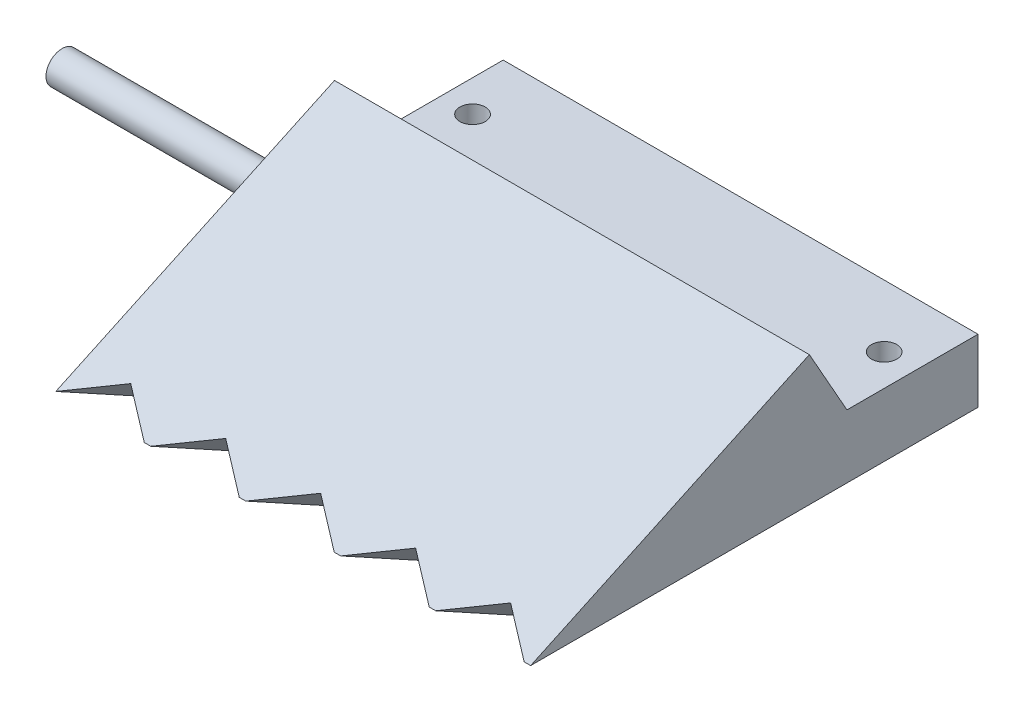
from build123d import *

# Parameters (mm, degrees)
BOSS_EXTRUDE1_DEPTH = 75
SKETCH2_R           = 2
CUT_EXTRUDE1_DEPTH  = 10
CUT_EXTRUDE2_DEPTH  = 10
CHAMFER1_SIZE       = 2
SKETCH3_R           = 2.543008444
BOSS_EXTRUDE2_DEPTH = 40


with BuildPart() as part:
    # Sketch1 → Boss-Extrude1 (new body)
    with BuildSketch(Plane(origin=(0, 0, 0), x_dir=(0, 0, -1), z_dir=(1, 0, 0))):
        Polygon((-35.447605249, 4.173188871), (35.206481481, 4.173188871), (35.206481481, 14.173188871), (14.511910864, 14.173188871), (8.571096195, 24.699446456), align=None)
    extrude(amount=BOSS_EXTRUDE1_DEPTH)

    # Sketch2 → Cut-Extrude1 (cut)
    with BuildSketch(Plane(origin=(0, 14.173188871, 0), x_dir=(1, 0, 0), z_dir=(0, 1, 0))):
        with Locations((5, 25.374559272)):
            Circle(SKETCH2_R)
        with Locations((69.999998955, 25.38621548)):
            Circle(SKETCH2_R)
    extrude(amount=-CUT_EXTRUDE1_DEPTH, mode=Mode.SUBTRACT)

    # Sketch4 → Cut-Extrude2 (cut)
    with BuildSketch(Plane(origin=(0, 17.005051997, 7.929585973), x_dir=(1, 0, 0), z_dir=(0, 0.9063077870366527, 0.4226182617406937))):
        Polygon((0, -30.362774842), (7.065850082, -25.103103439), (13.976560291, -30.362774842), align=None)
        Polygon((22.065850082, -25.103103439), (28.976560291, -30.362774842), (15, -30.362774842), align=None)
        Polygon((37.065850082, -25.103103439), (43.976560291, -30.362774842), (30, -30.362774842), align=None)
        Polygon((52.065850082, -25.103103439), (58.976560291, -30.362774842), (45, -30.362774842), align=None)
        Polygon((67.065850082, -25.103103439), (73.976560291, -30.362774842), (60, -30.362774842), align=None)
    extrude(amount=-CUT_EXTRUDE2_DEPTH, mode=Mode.SUBTRACT)

    # Chamfer1
    chamfer1_edges = [part.edges().sort_by_distance(p)[0] for p in [
        (67.999998955, 4.173188871, -25.38621548),
        (3, 4.173188871, -25.374559272),
    ]]
    chamfer(chamfer1_edges, length=CHAMFER1_SIZE)

    # Sketch3 → Boss-Extrude2 (add)
    with BuildSketch(Plane.ZY):
        with Locations((-5.547587106, 8.033515635)):
            Circle(SKETCH3_R)
    extrude(amount=BOSS_EXTRUDE2_DEPTH)


solid = part.part
